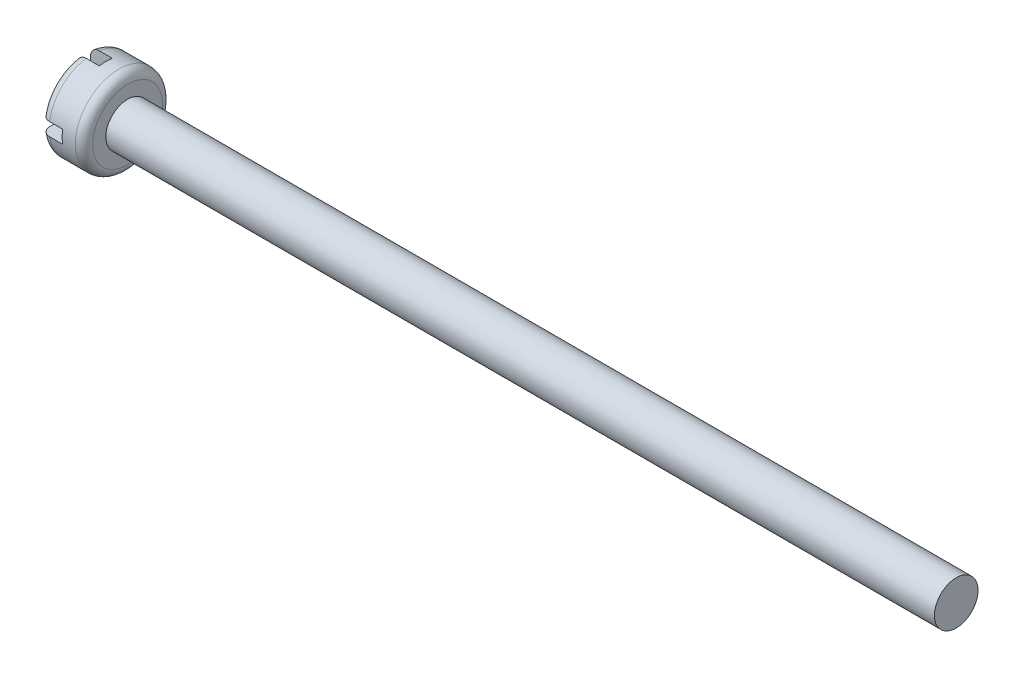
from build123d import *

# Parameters (mm, degrees)
SKETCH2_W          = 2
SKETCH2_H          = 0.3
SKETCH2_W_2        = 0.3
SKETCH2_H_2        = 2
CUT_EXTRUDE1_DEPTH = 0.5


with BuildPart() as part:
    # Sketch1 → Revolve1 (revolve)
    with BuildSketch(Plane.XY):
        with BuildLine():
            Line((0, 0.8), (0, 0))
            Line((0, 0), (20, 0))
            Line((20, 0), (20, 0.5))
            Line((20, 0.5), (1, 0.5))
            Line((1, 0.5), (1, 0.8))
            ThreePointArc((1, 0.8), (0.941421356, 0.941421356), (0.8, 1))
            Line((0.8, 1), (0.2, 1))
            ThreePointArc((0.2, 1), (0.058578644, 0.941421356), (0, 0.8))
        make_face()
    revolve(axis=Axis((0, 0, 0), (1, 0, 0)))

    # Sketch2 → Cut-Extrude1 (cut)
    with BuildSketch(Plane.ZY):
        Rectangle(SKETCH2_W, SKETCH2_H)
        Rectangle(SKETCH2_W_2, SKETCH2_H_2)
    extrude(amount=-CUT_EXTRUDE1_DEPTH, mode=Mode.SUBTRACT)


solid = part.part
